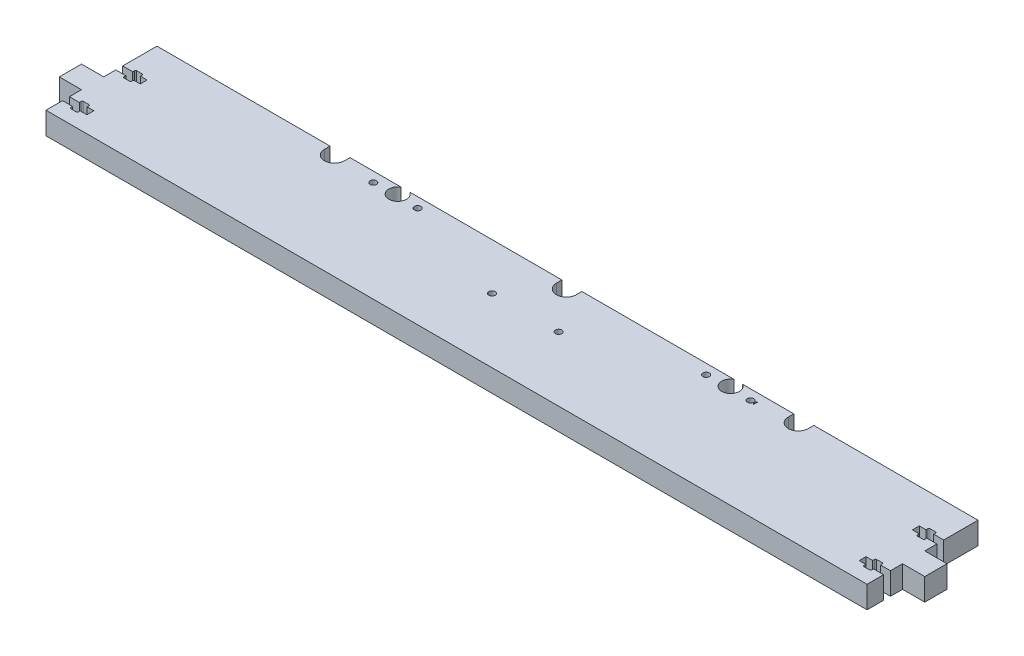
from build123d import *

# Parameters (mm, degrees)
MAINBODY_DEPTH                 = 10
SCREWCUTOUTS_DEPTH             = 197.85019685
SKETCH3_R                      = 4
SKETCH3_R_2                    = 1.45
RODCUTOUTS_DEPTH               = 197.85019685
SKETCH6_R                      = 1.45
CUT_EXTRUDE1_DEPTH             = 197.85019685
BEDADJUSTMENTSCREWCUTOUT_DEPTH = 197.85019685
DIRECTIONKEY_DEPTH             = 197.85019685
CUT_EXTRUDE2_DEPTH             = 197.85019685


with BuildPart() as part:
    # Sketch1 → MainBody (new body)
    with BuildSketch(Plane(origin=(0, 0, 0), x_dir=(1, 0, 0), z_dir=(0, 1, 0))):
        Polygon((0, -25), (0, 25), (-185, 25), (-185, 1), (-195, 1), (-195, -9), (-185, -9), (-185, -25), align=None)
    mainbody = extrude(amount=MAINBODY_DEPTH)

    # Sketch5 → ScrewCutouts (cut, through all)
    with BuildSketch(Plane(origin=(0, 10, 0), x_dir=(1, 0, 0), z_dir=(0, 1, 0))):
        with BuildLine():
            Line((-185, 9.55), (-180.5, 9.55))
            Line((-180.5, 9.55), (-180.5, 10.35))
            ThreePointArc((-180.5, 10.35), (-180.353553391, 10.703553391), (-180, 10.85))
            Line((-180, 10.85), (-177.5, 10.85))
            ThreePointArc((-177.5, 10.85), (-177.146446609, 10.703553391), (-177, 10.35))
            Line((-177, 10.35), (-177, 9.55))
            Line((-177, 9.55), (-174, 9.55))
            Line((-174, 9.55), (-174, 6.45))
            Line((-174, 6.45), (-177, 6.45))
            Line((-177, 6.45), (-177, 5.65))
            ThreePointArc((-177, 5.65), (-177.146446609, 5.296446609), (-177.5, 5.15))
            Line((-177.5, 5.15), (-180, 5.15))
            ThreePointArc((-180, 5.15), (-180.353553391, 5.296446609), (-180.5, 5.65))
            Line((-180.5, 5.65), (-180.5, 6.45))
            Line((-180.5, 6.45), (-185, 6.45))
            Line((-185, 6.45), (-185, 9.55))
        make_face()
        with BuildLine():
            Line((-185, -14.45), (-180.5, -14.45))
            Line((-180.5, -14.45), (-180.5, -13.65))
            ThreePointArc((-180.5, -13.65), (-180.353553391, -13.296446609), (-180, -13.15))
            Line((-180, -13.15), (-177.5, -13.15))
            ThreePointArc((-177.5, -13.15), (-177.146446609, -13.296446609), (-177, -13.65))
            Line((-177, -13.65), (-177, -14.45))
            Line((-177, -14.45), (-174, -14.45))
            Line((-174, -14.45), (-174, -17.55))
            Line((-174, -17.55), (-177, -17.55))
            Line((-177, -17.55), (-177, -18.35))
            ThreePointArc((-177, -18.35), (-177.146446609, -18.703553391), (-177.5, -18.85))
            Line((-177.5, -18.85), (-180, -18.85))
            ThreePointArc((-180, -18.85), (-180.353553391, -18.703553391), (-180.5, -18.35))
            Line((-180.5, -18.35), (-180.5, -17.55))
            Line((-180.5, -17.55), (-185, -17.55))
            Line((-185, -17.55), (-185, -14.45))
        make_face()
    screwcutouts = extrude(amount=-SCREWCUTOUTS_DEPTH, mode=Mode.SUBTRACT)

    # Mirror1: MainBody, ScrewCutouts across plane
    add(mainbody.mirror(Plane(origin=(0, 0, 0), x_dir=(0, 0, 1), z_dir=(1, 0, 0))))
    add(screwcutouts.mirror(Plane(origin=(0, 0, 0), x_dir=(0, 0, 1), z_dir=(1, 0, 0))), mode=Mode.SUBTRACT)

    # Sketch3 → RodCutouts (cut, through all)
    with BuildSketch(Plane(origin=(0, 10, 0), x_dir=(1, 0, 0), z_dir=(0, 1, 0))):
        with Locations((-73, 21.5)):
            Circle(SKETCH3_R)
        with Locations((-83, 20.5)):
            Circle(SKETCH3_R_2)
        with Locations((-63, 20.5)):
            Circle(SKETCH3_R_2)
        with Locations((67, 20.5)):
            Circle(SKETCH3_R_2)
        with Locations((87, 20.5)):
            Circle(SKETCH3_R_2)
        with Locations((77, 21.5)):
            Circle(SKETCH3_R)
    extrude(amount=-RODCUTOUTS_DEPTH, mode=Mode.SUBTRACT)

    # Sketch6 → Cut-Extrude1 (cut, through all)
    with BuildSketch(Plane(origin=(0, 10, 0), x_dir=(1, 0, 0), z_dir=(0, 1, 0))):
        with Locations((-13, 4)):
            Circle(SKETCH6_R)
        with Locations((17, 4)):
            Circle(SKETCH6_R)
    extrude(amount=-CUT_EXTRUDE1_DEPTH, mode=Mode.SUBTRACT)

    # Sketch7 → BedAdjustmentScrewCutout (cut, through all)
    with BuildSketch(Plane(origin=(0, 10, 0), x_dir=(1, 0, 0), z_dir=(0, 1, 0))):
        with BuildLine():
            Line((-98, 25), (-98, 22.5))
            ThreePointArc((-98, 22.5), (-102.5, 18), (-107, 22.5))
            Line((-107, 22.5), (-107, 25))
            ThreePointArc((-107, 25), (-102.5, 29.5), (-98, 25))
        make_face()
        with BuildLine():
            Line((102, 25), (102, 22.5))
            ThreePointArc((102, 22.5), (106.5, 18), (111, 22.5))
            Line((111, 22.5), (111, 25))
            ThreePointArc((111, 25), (106.5, 29.5), (102, 25))
        make_face()
    extrude(amount=-BEDADJUSTMENTSCREWCUTOUT_DEPTH, mode=Mode.SUBTRACT)

    # Sketch8 → DirectionKey (cut, through all)
    with BuildSketch(Plane(origin=(0, 10, 0), x_dir=(1, 0, 0), z_dir=(0, 1, 0))):
        Polygon((88.25, 20.5), (89.25, 21.5), (89.25, 19.5), align=None)
    extrude(amount=-DIRECTIONKEY_DEPTH, mode=Mode.SUBTRACT)

    # Sketch9 → Cut-Extrude2 (cut, through all)
    with BuildSketch(Plane(origin=(0, 10, 0), x_dir=(1, 0, 0), z_dir=(0, 1, 0))):
        with BuildLine():
            Line((6.5, 27.5), (6.5, 22.5))
            ThreePointArc((6.5, 22.5), (2, 18), (-2.5, 22.5))
            Line((-2.5, 22.5), (-2.5, 27.5))
            ThreePointArc((-2.5, 27.5), (2, 32), (6.5, 27.5))
        make_face()
    extrude(amount=-CUT_EXTRUDE2_DEPTH, mode=Mode.SUBTRACT)


solid = part.part
